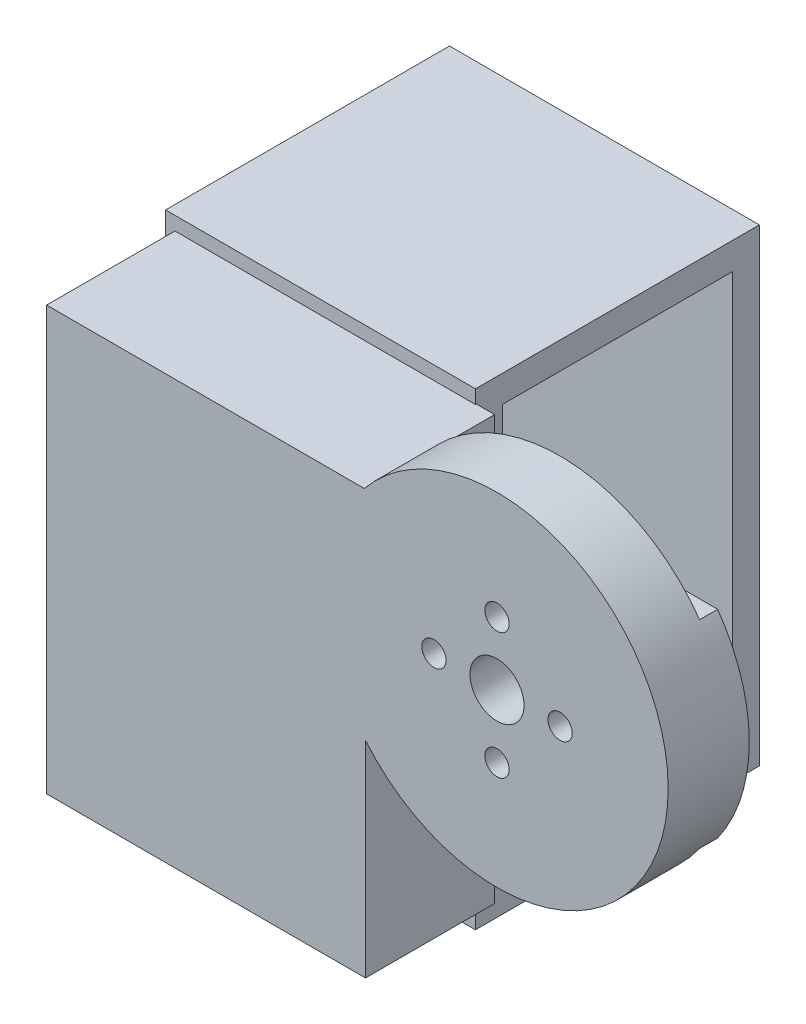
from build123d import *

# Parameters (mm, degrees)
S_CYL1_R      = 19
BOSS_1_DEPTH  = 7
BOSS_2_DEPTH  = 2.1
S_BOX3_W      = 28.5
S_BOX3_H      = 10
BOSS_3_DEPTH  = 1.5
S_BOX4_W      = 35.4
S_BOX4_H      = 47
BOSS_4_DEPTH  = 14.34
S_BOX5_W      = 34.4
S_BOX5_H      = 3
BOSS_5_DEPTH  = 31.52
S_BOX6_W      = 34.4
S_BOX6_H      = 3
BOSS_6_DEPTH  = 31.52
S_BOX7_W      = 34.4
S_BOX7_H      = 52.02
BOSS_7_DEPTH  = 3
S_BOX8_W      = 34.4
S_BOX8_H      = 52.02
BOSS_8_DEPTH  = 3
S_BOX9_W      = 2.4
S_BOX9_H      = 52.02
BOSS_9_DEPTH  = 31.52
S_HOLE10_R    = 11
HOLE_10_DEPTH = 2.6
S_HOLE11_R    = 1.1
HOLE_11_DEPTH = 2.6
S_HOLE12_R    = 1.1
HOLE_12_DEPTH = 2.6
S_HOLE13_R    = 1.1
HOLE_13_DEPTH = 2.6
S_HOLE14_R    = 3
HOLE_14_DEPTH = 10.6
S_HOLE15_R    = 1.35
HOLE_15_DEPTH = 10.6
S_HOLE16_R    = 1.35
HOLE_16_DEPTH = 10.6
S_HOLE17_R    = 1.35
HOLE_17_DEPTH = 10.6
S_HOLE18_R    = 1.35
HOLE_18_DEPTH = 10.6
S_HOLE19_R    = 2.3
HOLE_19_DEPTH = 4.5
S_HOLE20_R    = 2.3
HOLE_20_DEPTH = 4.5
S_HOLE21_R    = 2.3
HOLE_21_DEPTH = 4.5
S_HOLE22_R    = 2.3
HOLE_22_DEPTH = 4.5


with BuildPart() as part:
    # S_cyl1 → Boss_1 (new body)
    with BuildSketch(Plane.XY.offset(23)):
        Circle(S_CYL1_R)
    extrude(amount=BOSS_1_DEPTH)

    # S_prism2 → Boss_2 (add)
    with BuildSketch(Plane.XY.offset(21)):
        with BuildLine():
            Line((-15.491933385, -11), (15.491933385, -11))
            ThreePointArc((15.491933385, -11), (19, 0), (15.491933385, 11))
            Line((15.491933385, 11), (-15.491933385, 11))
            ThreePointArc((-15.491933385, 11), (-19, 0), (-15.491933385, -11))
        make_face()
    extrude(amount=BOSS_2_DEPTH)

    # S_box3 → Boss_3 (add)
    with BuildSketch(Plane.XY.offset(19.6)):
        with Locations((-0.25, 0)):
            Rectangle(S_BOX3_W, S_BOX3_H)
    extrude(amount=BOSS_3_DEPTH)

    # S_box4 → Boss_4 (add)
    with BuildSketch(Plane.XY.offset(15.66)):
        with Locations((-32.3, -11.5)):
            Rectangle(S_BOX4_W, S_BOX4_H)
    extrude(amount=BOSS_4_DEPTH)

    # S_box6 → Boss_6 (add)
    with BuildSketch(Plane.XY.offset(-15.76)):
        with Locations((-33.835, 12.01)):
            Rectangle(S_BOX6_W, S_BOX6_H)
    extrude(amount=BOSS_6_DEPTH)



with BuildPart() as body_2:
    # S_box5 → Boss_5 (new body)
    with BuildSketch(Plane.XY.offset(-15.76)):
        with Locations((-33.835, -37.01)):
            Rectangle(S_BOX5_W, S_BOX5_H)
    extrude(amount=BOSS_5_DEPTH)


with BuildPart() as part_1:
    add(part.part)

    add(body_2.part)  # Boss_7 merges body 2
    # S_box7 → Boss_7 (add)
    with BuildSketch(Plane.XY.offset(-15.76)):
        with Locations((-33.835, -12.5)):
            Rectangle(S_BOX7_W, S_BOX7_H)
    extrude(amount=BOSS_7_DEPTH)

    # S_box8 → Boss_8 (add)
    with BuildSketch(Plane.XY.offset(12.76)):
        with Locations((-33.835, -12.5)):
            Rectangle(S_BOX8_W, S_BOX8_H)
    extrude(amount=BOSS_8_DEPTH)

    # S_box9 → Boss_9 (add)
    with BuildSketch(Plane.XY.offset(-15.76)):
        with Locations((-49.835, -12.5)):
            Rectangle(S_BOX9_W, S_BOX9_H)
    extrude(amount=BOSS_9_DEPTH)

    # S_hole10 → Hole_10 (cut)
    with BuildSketch(Plane(origin=(-51.135, 0, 0), x_dir=(0, 0, -1), z_dir=(1, 0, 0))):
        Circle(S_HOLE10_R)
    extrude(amount=HOLE_10_DEPTH, mode=Mode.SUBTRACT)

    # S_hole11 → Hole_11 (cut)
    with BuildSketch(Plane(origin=(-51.135, 0, 0), x_dir=(0, 0, -1), z_dir=(1, 0, 0))):
        with Locations((-10.25, -8.3)):
            Circle(S_HOLE11_R)
    extrude(amount=HOLE_11_DEPTH, mode=Mode.SUBTRACT)

    # S_hole12 → Hole_12 (cut)
    with BuildSketch(Plane(origin=(-51.135, 0, 0), x_dir=(0, 0, -1), z_dir=(1, 0, 0))):
        with Locations((10.25, -32.75)):
            Circle(S_HOLE12_R)
    extrude(amount=HOLE_12_DEPTH, mode=Mode.SUBTRACT)

    # S_hole13 → Hole_13 (cut)
    with BuildSketch(Plane(origin=(-51.135, 0, 0), x_dir=(0, 0, -1), z_dir=(1, 0, 0))):
        with Locations((-10.25, -32.75)):
            Circle(S_HOLE13_R)
    extrude(amount=HOLE_13_DEPTH, mode=Mode.SUBTRACT)

    # S_hole14 → Hole_14 (cut)
    with BuildSketch(Plane.XY.offset(19.5)):
        Circle(S_HOLE14_R)
    extrude(amount=HOLE_14_DEPTH, mode=Mode.SUBTRACT)

    # S_hole15 → Hole_15 (cut)
    with BuildSketch(Plane.XY.offset(19.5)):
        with Locations((7, 0)):
            Circle(S_HOLE15_R)
    extrude(amount=HOLE_15_DEPTH, mode=Mode.SUBTRACT)

    # S_hole16 → Hole_16 (cut)
    with BuildSketch(Plane.XY.offset(19.5)):
        with Locations((0, 7)):
            Circle(S_HOLE16_R)
    extrude(amount=HOLE_16_DEPTH, mode=Mode.SUBTRACT)

    # S_hole17 → Hole_17 (cut)
    with BuildSketch(Plane.XY.offset(19.5)):
        with Locations((-7, 0)):
            Circle(S_HOLE17_R)
    extrude(amount=HOLE_17_DEPTH, mode=Mode.SUBTRACT)

    # S_hole18 → Hole_18 (cut)
    with BuildSketch(Plane.XY.offset(19.5)):
        with Locations((0, -7)):
            Circle(S_HOLE18_R)
    extrude(amount=HOLE_18_DEPTH, mode=Mode.SUBTRACT)

    # S_hole19 → Hole_19 (cut)
    with BuildSketch(Plane.XY.offset(19.5)):
        with Locations((7, 0)):
            Circle(S_HOLE19_R)
    extrude(amount=HOLE_19_DEPTH, mode=Mode.SUBTRACT)

    # S_hole20 → Hole_20 (cut)
    with BuildSketch(Plane.XY.offset(19.5)):
        with Locations((0, 7)):
            Circle(S_HOLE20_R)
    extrude(amount=HOLE_20_DEPTH, mode=Mode.SUBTRACT)

    # S_hole21 → Hole_21 (cut)
    with BuildSketch(Plane.XY.offset(19.5)):
        with Locations((-7, 0)):
            Circle(S_HOLE21_R)
    extrude(amount=HOLE_21_DEPTH, mode=Mode.SUBTRACT)

    # S_hole22 → Hole_22 (cut)
    with BuildSketch(Plane.XY.offset(19.5)):
        with Locations((0, -7)):
            Circle(S_HOLE22_R)
    extrude(amount=HOLE_22_DEPTH, mode=Mode.SUBTRACT)


solid = part_1.part
